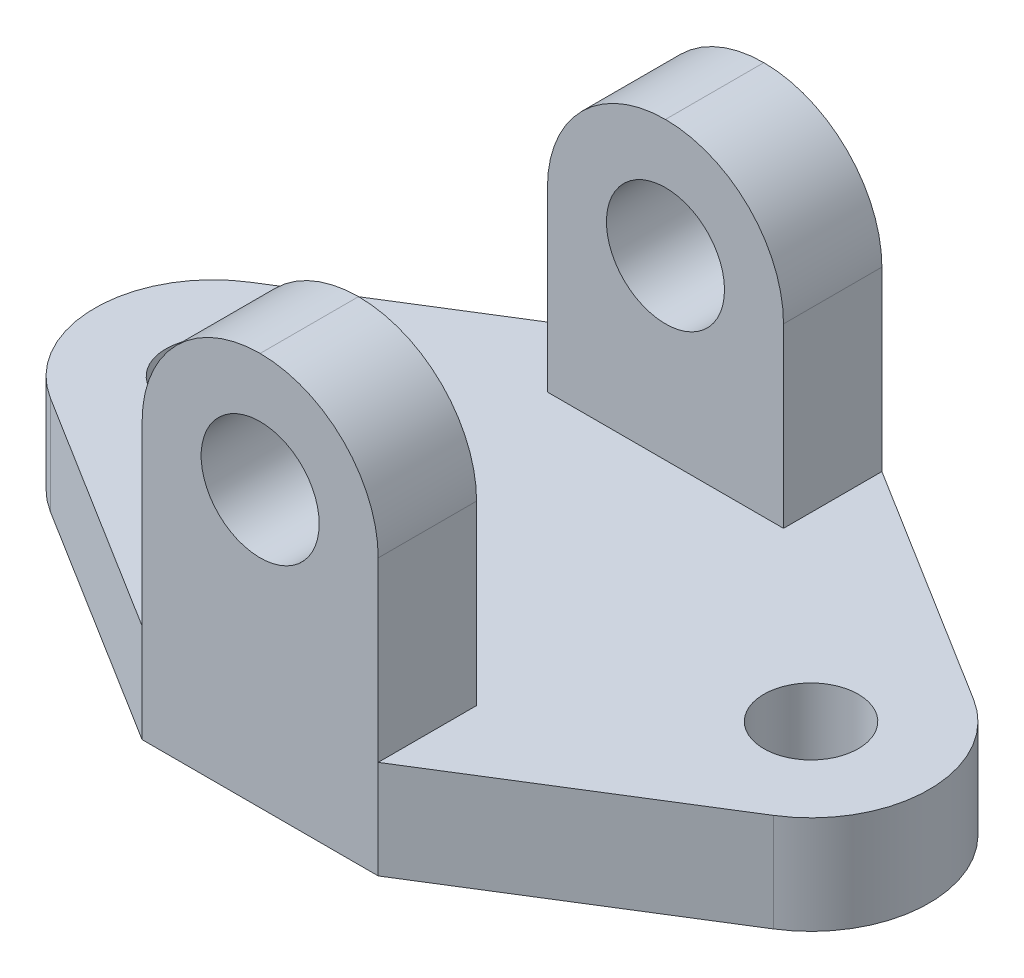
from build123d import *

# Parameters (mm, degrees)
SKETCH1_R            = 6
BOSS_EXTRUDE1_DEPTH  = 12.5
SKETCH2_W            = 30
SKETCH2_H            = 50
SKETCH2_R            = 7.5
BOSS_EXTRUDE2_DEPTH  = 12.5
FILLET1_R            = 15
FILLET1_OF_MIRROR1_R = 15


with BuildPart() as part:
    # Sketch1 → Boss-Extrude1 (new body)
    with BuildSketch(Plane(origin=(0, 0, 0), x_dir=(1, 0, 0), z_dir=(0, 1, 0))):
        with BuildLine():
            Line((-45.931122004, 12.73174394), (-15, 32))
            Line((-15, 32), (15, 32))
            Line((15, 32), (45.931122004, 12.73174394))
            ThreePointArc((45.931122004, 12.73174394), (53, 0), (45.931122004, -12.73174394))
            Line((45.931122004, -12.73174394), (15, -32))
            Line((15, -32), (-15, -32))
            Line((-15, -32), (-45.931122004, -12.73174394))
            ThreePointArc((-45.931122004, -12.73174394), (-53, 0), (-45.931122004, 12.73174394))
        make_face()
        with Locations(Location((-38, 0, 0), (0, 0, 270))):
            Circle(SKETCH1_R, mode=Mode.SUBTRACT)
        with Locations(Location((38, 0, 0), (0, 0, 90))):
            Circle(SKETCH1_R, mode=Mode.SUBTRACT)
    extrude(amount=BOSS_EXTRUDE1_DEPTH)

    # Sketch2 → Boss-Extrude2 (add)
    with BuildSketch(Plane.XY.offset(32)):
        with Locations((0, 25)):
            Rectangle(SKETCH2_W, SKETCH2_H)
        with Locations((0, 35)):
            Circle(SKETCH2_R, mode=Mode.SUBTRACT)
    boss_extrude2 = extrude(amount=-BOSS_EXTRUDE2_DEPTH)

    # Fillet1
    fillet1_edges = [part.edges().sort_by_distance(p)[0] for p in [
        (15, 50, 25.75),
        (-15, 50, 25.75),
    ]]
    fillet(fillet1_edges, radius=FILLET1_R - 0.0001)  # a hair under: the kernel refuses the full size

    # Mirror1: Boss-Extrude2 across plane
    add(boss_extrude2.mirror(Plane.XY))

    # Fillet1 of Mirror1
    fillet1_of_mirror1_edges = [part.edges().sort_by_distance(p)[0] for p in [
        (15, 50, -25.75),
        (-15, 50, -25.75),
    ]]
    fillet(fillet1_of_mirror1_edges, radius=FILLET1_OF_MIRROR1_R - 0.0001)  # a hair under: the kernel refuses the full size


solid = part.part
